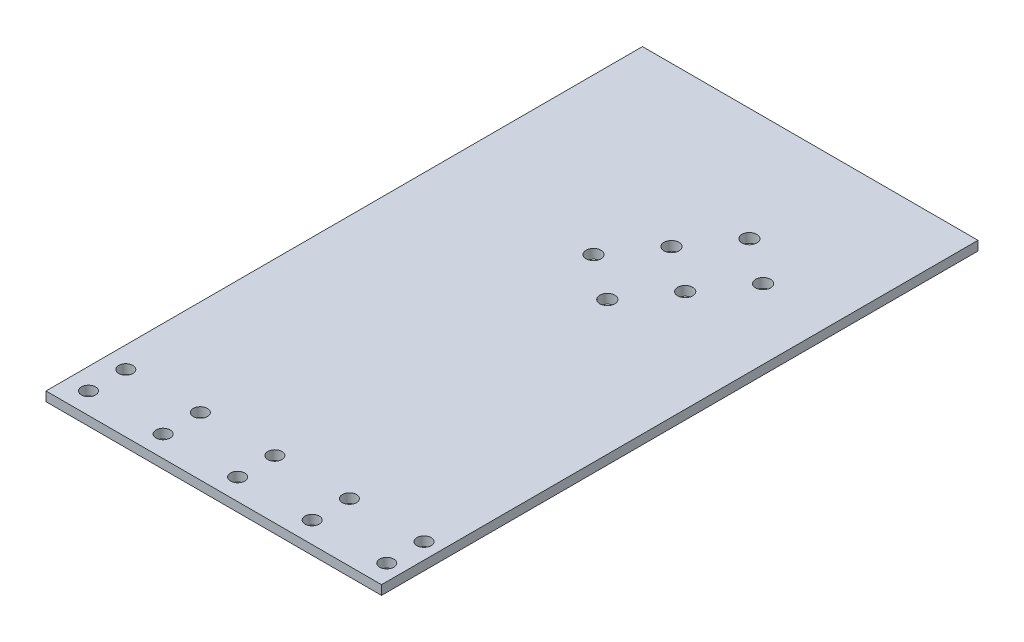
from build123d import *

# Parameters (mm, degrees)
SKETCH1_W           = 114.3
SKETCH1_H           = 203.2
BOSS_EXTRUDE1_DEPTH = 3.175
SKETCH2_R           = 2.413
CUT_EXTRUDE1_DEPTH  = 234.16262699
SKETCH3_R           = 2.5527
CUT_EXTRUDE2_DEPTH  = 234.16262699


with BuildPart() as part:
    # Sketch1 → Boss-Extrude1 (new body)
    with BuildSketch(Plane(origin=(0, 0, 0), x_dir=(1, 0, 0), z_dir=(0, 1, 0))):
        with Locations((57.15, 101.6)):
            Rectangle(SKETCH1_W, SKETCH1_H)
    extrude(amount=BOSS_EXTRUDE1_DEPTH)

    # Sketch2 → Cut-Extrude1 (cut, through all)
    with BuildSketch(Plane(origin=(0, 3.175, 0), x_dir=(1, 0, 0), z_dir=(0, 1, 0))):
        with Locations((7.239, 7.239)):
            Circle(SKETCH2_R)
        with Locations((7.239, 19.939)):
            Circle(SKETCH2_R)
        with Locations((32.639, 19.939)):
            Circle(SKETCH2_R)
        with Locations((58.039, 19.939)):
            Circle(SKETCH2_R)
        with Locations((83.439, 19.939)):
            Circle(SKETCH2_R)
        with Locations((108.839, 19.939)):
            Circle(SKETCH2_R)
        with Locations((32.639, 7.239)):
            Circle(SKETCH2_R)
        with Locations((58.039, 7.239)):
            Circle(SKETCH2_R)
        with Locations((83.439, 7.239)):
            Circle(SKETCH2_R)
        with Locations((108.839, 7.239)):
            Circle(SKETCH2_R)
    extrude(amount=-CUT_EXTRUDE1_DEPTH, mode=Mode.SUBTRACT)

    # Sketch3 → Cut-Extrude2 (cut, through all)
    with BuildSketch(Plane(origin=(0, 3.175, 0), x_dir=(1, 0, 0), z_dir=(0, 1, 0))):
        with Locations((74.876194266, 164.731389258)):
            Circle(SKETCH3_R)
        with Locations((90.481040709, 153.804758146)):
            Circle(SKETCH3_R)
        with Locations((63.949563153, 149.126542814)):
            Circle(SKETCH3_R)
        with Locations((79.554409597, 138.199911702)):
            Circle(SKETCH3_R)
        with Locations((53.022932041, 133.521696371)):
            Circle(SKETCH3_R)
        with Locations((68.627778484, 122.595065258)):
            Circle(SKETCH3_R)
    extrude(amount=-CUT_EXTRUDE2_DEPTH, mode=Mode.SUBTRACT)


solid = part.part
